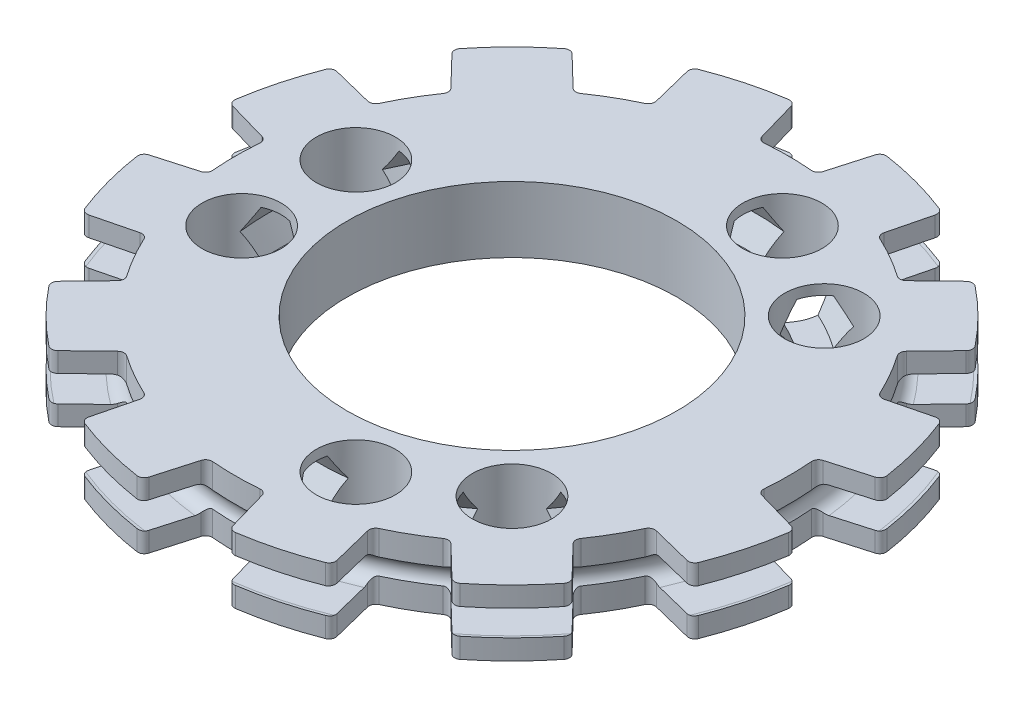
from build123d import *

# Parameters (mm, degrees)
SKETCH_1_W                       = 50
SKETCH_1_H                       = 10
SKETCH_7_W                       = 25
SKETCH_7_H                       = 10
CUT_REVOLVE_START                = -5
CUT_REVOLVE_1_DEPTH              = 10
SKETCH_5_W                       = 10
SKETCH_5_H                       = 10
CUT_REVOLVE_4_ANGLE              = 10
SKETCH_6_W                       = 10
SKETCH_6_H                       = 10
CUT_REVOLVE_5_ANGLE              = 10
FILLET_2_R                       = 1
PATTERN_CIRCULAR_1_COUNT         = 12
FILLET_2_OF_PATTERN_CIRCULAR_1_R = 1
SKETCH_12_W                      = 6
SKETCH_12_H                      = 10
PATTERN_CIRCULAR_4_COUNT         = 12


# Read off the part's stored shape, not the designer's step: Вырез-Повернуть1
with BuildPart() as part:
    # Эскиз1 → Повернуть1 (revolve)
    with BuildSketch(Plane.XY, mode=Mode.PRIVATE) as revolve_1_sk:
        with Locations((25, 0)):
            Rectangle(SKETCH_1_W, SKETCH_1_H)
    revolve(revolve_1_sk.sketch.rotate(Axis((0, -5, 0), (0, 1, 0)), 90), axis=Axis((0, -5, 0), (0, 1, 0)))

    # Эскиз7 → Вырез-Повернуть6 (revolve, cut)
    with BuildSketch(Plane.XY, mode=Mode.PRIVATE) as cut_revolve_6_sk:
        with Locations((12.5, 0)):
            Rectangle(SKETCH_7_W, SKETCH_7_H)
    revolve(cut_revolve_6_sk.sketch.rotate(Axis((0, 5, 0), (0, -1, 0)), 90), axis=Axis((0, 5, 0), (0, -1, 0)), mode=Mode.SUBTRACT)

    # Вырез-Повернуть1 outline → Вырез-Повернуть1 (cut)
    with BuildSketch(Plane(origin=(0, 0, 0), x_dir=(1, 0, 0), z_dir=(0, 1, 0)).offset(CUT_REVOLVE_START)):
        with BuildLine():
            ThreePointArc((41.769919605, 4.390195457), (42, 0), (41.769919605, -4.390195457))
            Line((41.769919605, -4.390195457), (49.726094768, -5.226423163))
            ThreePointArc((49.726094768, -5.226423163), (50, 0), (49.726094768, 5.226423163))
            Line((49.726094768, 5.226423163), (41.769919605, 4.390195457))
        make_face()
    cut_revolve_1 = extrude(amount=CUT_REVOLVE_1_DEPTH, mode=Mode.SUBTRACT)

    # Эскиз5 → Вырез-Повернуть4 (revolve, cut)
    with BuildSketch(Plane(origin=(0, 0, 0), x_dir=(0.9945218953682733, 0, -0.10452846326765368), z_dir=(0.10452846326765368, 0, 0.9945218953682733))):
        with Locations((47, 0)):
            Rectangle(SKETCH_5_W, SKETCH_5_H)
    cut_revolve_4 = revolve(axis=Axis((41.769919605, 5, -4.390195457), (0, 1, 0)), revolution_arc=CUT_REVOLVE_4_ANGLE, mode=Mode.SUBTRACT)

    # Эскиз6 → Вырез-Повернуть5 (revolve, cut)
    with BuildSketch(Plane(origin=(0, 0, 0), x_dir=(-0.9945218953682733, 0, -0.10452846326765368), z_dir=(0.10452846326765368, 0, -0.9945218953682733))):
        with Locations((-47, 0)):
            Rectangle(SKETCH_6_W, SKETCH_6_H)
    cut_revolve_5 = revolve(axis=Axis((41.769919605, 5, 4.390195457), (0, -1, 0)), revolution_arc=CUT_REVOLVE_5_ANGLE, mode=Mode.SUBTRACT)

    # Скругление2
    fillet_2_edges = [part.edges().sort_by_distance(p)[0] for p in [
        (41.769919605, 0, -4.390195457),
        (41.769919605, 0, 4.390195457),
        (49.559314861, 0, -6.623768605),
        (49.559314861, 0, 6.623768605),
    ]]
    fillet(fillet_2_edges, radius=FILLET_2_R)

    # Круговой массив1: Вырез-Повернуть1, Вырез-Повернуть4, Вырез-Повернуть5 ×12 about axis
    pattern_circular_1_axis = Axis((0, 0, 0), (0, 1, 0))
    add([cut_revolve_1.rotate(pattern_circular_1_axis, i * 360 / PATTERN_CIRCULAR_1_COUNT) for i in range(1, PATTERN_CIRCULAR_1_COUNT)], mode=Mode.SUBTRACT)
    add([cut_revolve_4.rotate(pattern_circular_1_axis, i * 360 / PATTERN_CIRCULAR_1_COUNT) for i in range(1, PATTERN_CIRCULAR_1_COUNT)], mode=Mode.SUBTRACT)
    add([cut_revolve_5.rotate(pattern_circular_1_axis, i * 360 / PATTERN_CIRCULAR_1_COUNT) for i in range(1, PATTERN_CIRCULAR_1_COUNT)], mode=Mode.SUBTRACT)

    # Скругление2 of Круговой массив1
    fillet_2_of_pattern_circular_1_edges = [part.edges().sort_by_distance(p)[0] for p in [
        (33.978713763, 0, -24.686980596),
        (38.36890922, 0, -17.082939009),
        (39.607741361, 0, -30.516009311),
        (46.231509966, 0, -19.04330555),
        (17.082939009, 0, -38.36890922),
        (24.686980596, 0, -33.978713763),
        (19.04330555, 0, -46.231509966),
        (30.516009311, 0, -39.607741361),
        (-4.390195457, 0, -41.769919605),
        (4.390195457, 0, -41.769919605),
        (-6.623768605, 0, -49.559314861),
        (6.623768605, 0, -49.559314861),
        (-24.686980596, 0, -33.978713763),
        (-17.082939009, 0, -38.36890922),
        (-30.516009311, 0, -39.607741361),
        (-19.04330555, 0, -46.231509966),
        (-38.36890922, 0, -17.082939009),
        (-33.978713763, 0, -24.686980596),
        (-46.231509966, 0, -19.04330555),
        (-39.607741361, 0, -30.516009311),
        (-41.769919605, 0, 4.390195457),
        (-41.769919605, 0, -4.390195457),
        (-49.559314861, 0, 6.623768605),
        (-49.559314861, 0, -6.623768605),
        (-33.978713763, 0, 24.686980596),
        (-38.36890922, 0, 17.082939009),
        (-39.607741361, 0, 30.516009311),
        (-46.231509966, 0, 19.04330555),
        (-17.082939009, 0, 38.36890922),
        (-24.686980596, 0, 33.978713763),
        (-19.04330555, 0, 46.231509966),
        (-30.516009311, 0, 39.607741361),
        (4.390195457, 0, 41.769919605),
        (-4.390195457, 0, 41.769919605),
        (6.623768605, 0, 49.559314861),
        (-6.623768605, 0, 49.559314861),
        (24.686980596, 0, 33.978713763),
        (17.082939009, 0, 38.36890922),
        (30.516009311, 0, 39.607741361),
        (19.04330555, 0, 46.231509966),
        (38.36890922, 0, 17.082939009),
        (33.978713763, 0, 24.686980596),
        (46.231509966, 0, 19.04330555),
        (39.607741361, 0, 30.516009311),
    ]]
    fillet(fillet_2_of_pattern_circular_1_edges, radius=FILLET_2_OF_PATTERN_CIRCULAR_1_R)

    # Эскиз9 → Вырез-Повернуть8 (revolve, cut)
    with BuildSketch(Plane.XY, mode=Mode.PRIVATE) as cut_revolve_8_sk:
        with BuildLine():
            Line((-43.559455812, -2), (-49.559455812, -2))
            ThreePointArc((-49.559455812, -2), (-51.559455812, 0), (-49.559455812, 2))
            Line((-49.559455812, 2), (-43.559455812, 2))
            ThreePointArc((-43.559455812, 2), (-41.559455812, 0), (-43.559455812, -2))
        make_face()
    revolve(cut_revolve_8_sk.sketch.rotate(Axis((0, -5, 0), (0, -1, 0)), 265.120068398), axis=Axis((0, -5, 0), (0, -1, 0)), mode=Mode.SUBTRACT)

    # Эскиз10 → Вырез-Повернуть9 (revolve, cut)
    with BuildSketch(Plane.XY, mode=Mode.PRIVATE) as cut_revolve_9_sk:
        Polygon((-31, 3.464101615), (-35, 3.464101615), (-37, 0), (-35, -3.464101615), (-31, -3.464101615), (-29, 0), align=None)
    revolve(cut_revolve_9_sk.sketch.rotate(Axis((0, -5, 0), (0, -1, 0)), 270), axis=Axis((0, -5, 0), (0, -1, 0)), mode=Mode.SUBTRACT)

    # Эскиз12 → Вырез-Повернуть10 (revolve, cut)
    with BuildSketch(Plane(origin=(0, 0, 0), x_dir=(0.25881904510253145, 0, -0.9659258262890655), z_dir=(0.9659258262890654, 0, 0.2588190451025314)), mode=Mode.PRIVATE) as cut_revolve_10_sk:
        with Locations((36.5, 0)):
            Rectangle(SKETCH_12_W, SKETCH_12_H)
    cut_revolve_10 = revolve(cut_revolve_10_sk.sketch.rotate(Axis((8.670438011, 5, -32.358515181), (0, -1, 0)), 165), axis=Axis((8.670438011, 5, -32.358515181), (0, -1, 0)), mode=Mode.SUBTRACT)

    # Круговой массив4: Вырез-Повернуть10 ×12 about axis, 6 skipped
    pattern_circular_4_axis = Axis((0, 5, 0), (0, 1, 0))
    add([cut_revolve_10.rotate(pattern_circular_4_axis, i * 360 / PATTERN_CIRCULAR_4_COUNT) for i in range(1, PATTERN_CIRCULAR_4_COUNT) if i not in (1, 2, 5, 6, 9, 10)], mode=Mode.SUBTRACT)


solid = part.part
